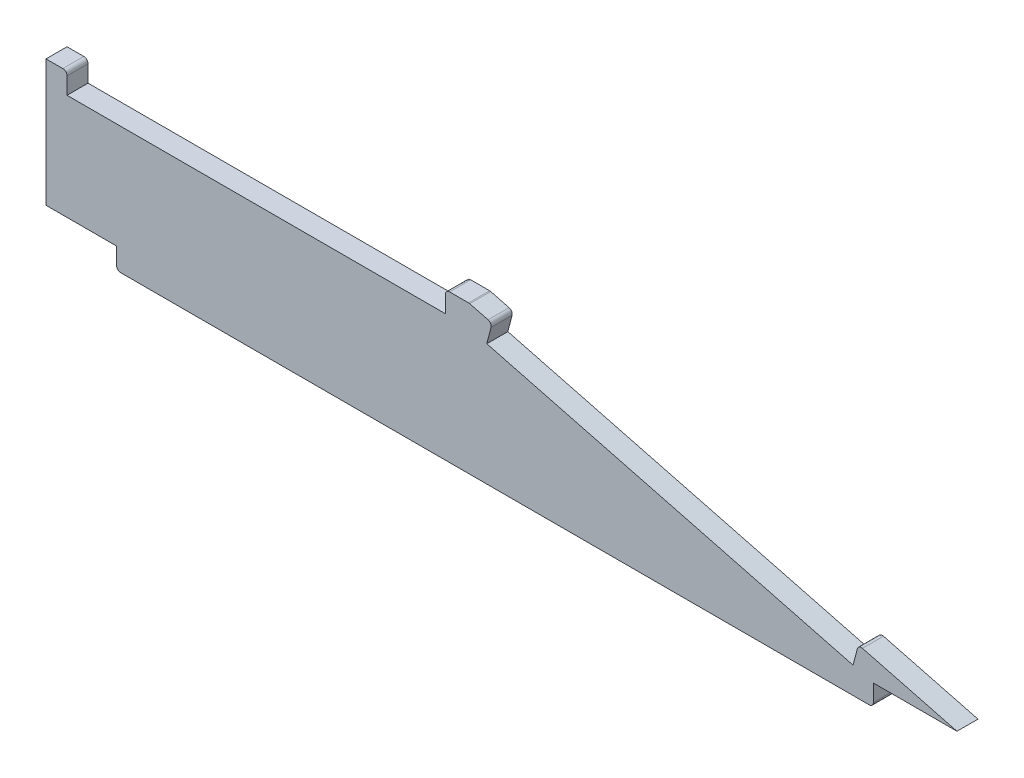
from build123d import *

# Parameters (mm, degrees)
BOSS_EXTRUDE1_DEPTH = 5
FILLET1_R           = 1


with BuildPart() as part:
    # Sketch1 → Boss-Extrude1 (new body)
    with BuildSketch(Plane.XY):
        Polygon((29.405194241, 5), (46.188102842, 5), (46.188102842, 0), (226.188102842, 0), (226.188102842, 5), (246.060241867, 5), (222.607000141, 11.097188159), (221.348957412, 6.258042728), (134.244339671, 28.902811841), (135.5023824, 33.741957272), (130.044499116, 35.16085457), (124.405194241, 35.16085457), (124.405194241, 30.16085457), (34.405194241, 30.16085457), (34.405194241, 35.16085457), (29.405194241, 35.16085457), align=None)
    extrude(amount=BOSS_EXTRUDE1_DEPTH)

    # Fillet1
    fillet1_edges = [part.edges().sort_by_distance(p)[0] for p in [
        (226.188102842, 0, 2.5),
        (46.188102842, 0, 2.5),
        (34.405194241, 35.16085457, 2.5),
        (124.405194241, 35.16085457, 2.5),
        (130.044499116, 35.16085457, 2.5),
        (135.5023824, 33.741957272, 2.5),
        (222.607000141, 11.097188159, 2.5),
    ]]
    fillet(fillet1_edges, radius=FILLET1_R)


solid = part.part
